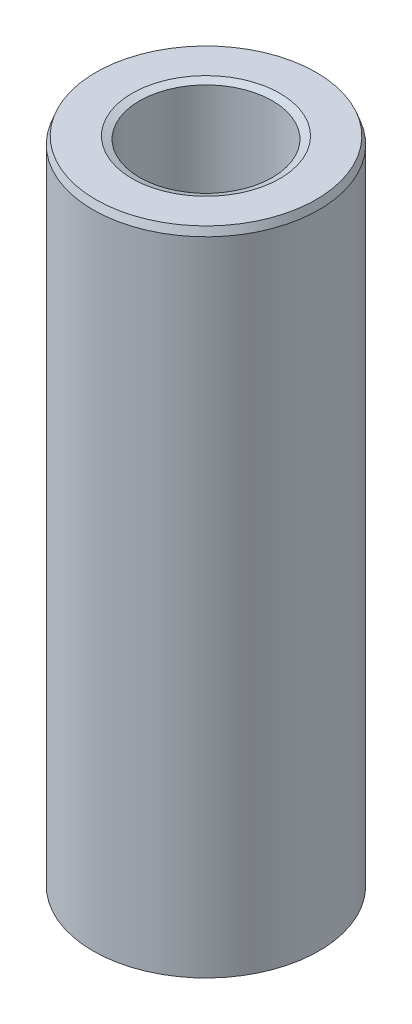
from build123d import *
from OCP.BRepFilletAPI import BRepFilletAPI_MakeChamfer

# Parameters (mm, degrees)
SKETCH1_R           = 55
BOSS_EXTRUDE1_DEPTH = 317.559864522
SKETCH2_R           = 32.349879103
CUT_EXTRUDE1_DEPTH  = 327.946887973
CHAMFER1_SIZE       = 3.653332187
CHAMFER1_SIZE2      = 1.335150401


with BuildPart() as part:
    # Sketch1 → Boss-Extrude1 (new body)
    with BuildSketch(Plane(origin=(0, 0, 0), x_dir=(1, 0, 0), z_dir=(0, 1, 0))):
        Circle(SKETCH1_R)
    extrude(amount=BOSS_EXTRUDE1_DEPTH)

    # Sketch2 → Cut-Extrude1 (cut, through all)
    with BuildSketch(Plane(origin=(0, 0, 0), x_dir=(1, 0, 0), z_dir=(0, 1, 0))):
        Circle(SKETCH2_R)
    extrude(amount=CUT_EXTRUDE1_DEPTH, mode=Mode.SUBTRACT)

    # Chamfer1: one chamfer whose edges measure the first distance from different faces: ONE call of the kernel's chamfer builder (chamfer() names one face for all edges)
    chamfer1_edges_1 = [part.edges().sort_by_distance(p)[0] for p in [
        (-32.349879103, 317.559864522, 0),
    ]]
    chamfer1_side_1 = [part.faces().sort_by_distance(p)[0] for p in [
        (-53.444365081, 317.559864522, 0),
    ]]
    chamfer1_edges_2 = [part.edges().sort_by_distance(p)[0] for p in [
        (-32.349879103, 0, 0),
    ]]
    chamfer1_side_2 = [part.faces().sort_by_distance(p)[0] for p in [
        (-32.349879103, 158.779932261, 0),
    ]]
    chamfer1_edges_3 = [part.edges().sort_by_distance(p)[0] for p in [
        (-55, 0, 0),
    ]]
    chamfer1_side_3 = [part.faces().sort_by_distance(p)[0] for p in [
        (-53.444365081, 0, 0),
    ]]
    chamfer1_edges_4 = [part.edges().sort_by_distance(p)[0] for p in [
        (-55, 317.559864522, 0),
    ]]
    chamfer1_side_4 = [part.faces().sort_by_distance(p)[0] for p in [
        (-55, 158.779932261, 0),
    ]]
    chamfer1 = BRepFilletAPI_MakeChamfer(part.part.solid().wrapped)
    for e in chamfer1_edges_1:
        chamfer1.Add(CHAMFER1_SIZE, CHAMFER1_SIZE2, e.wrapped, chamfer1_side_1[0].wrapped)  # the first distance lies on this face
    for e in chamfer1_edges_2:
        chamfer1.Add(CHAMFER1_SIZE, CHAMFER1_SIZE2, e.wrapped, chamfer1_side_2[0].wrapped)  # the first distance lies on this face
    for e in chamfer1_edges_3:
        chamfer1.Add(CHAMFER1_SIZE, CHAMFER1_SIZE2, e.wrapped, chamfer1_side_3[0].wrapped)  # the first distance lies on this face
    for e in chamfer1_edges_4:
        chamfer1.Add(CHAMFER1_SIZE, CHAMFER1_SIZE2, e.wrapped, chamfer1_side_4[0].wrapped)  # the first distance lies on this face
    add(Compound.cast(chamfer1.Shape()), mode=Mode.REPLACE)


solid = part.part
